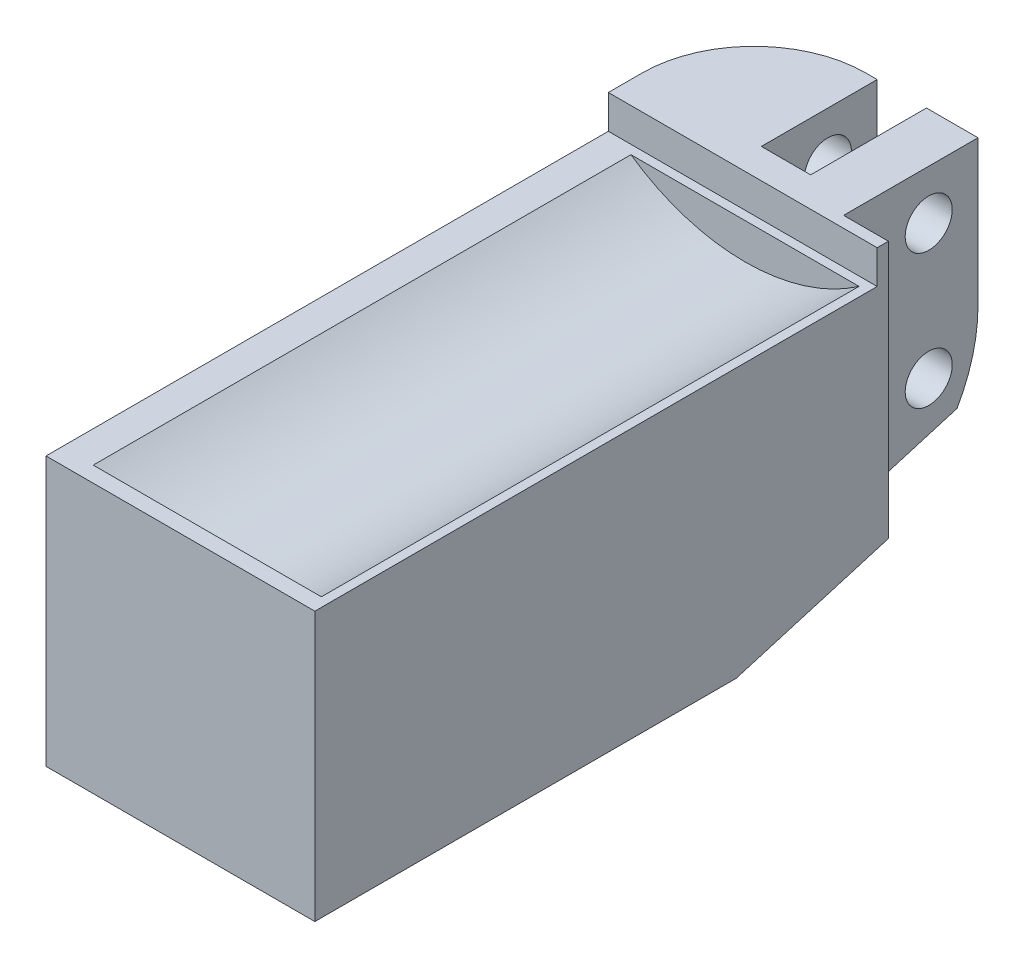
from build123d import *

# Parameters (mm, degrees)
BOSS_EXTRUDE1_DEPTH            = 3
BOSS_EXTRUDE1_DEPTH_BACK       = 12.8
SKETCH1_W                      = 6
SKETCH1_H                      = 6
SKETCH10_W                     = 6
SKETCH10_H                     = 3.25
BOSS_EXTRUDE2_DEPTH            = 0.75
CUT_EXTRUDE2_DEPTH             = 0.1
CUT_EXTRUDE2_DEPTH_BACK        = 1
CUT_EXTRUDE3_DEPTH             = 5.5
CUT_EXTRUDE3_DEPTH_BACK        = 6.5
SKETCH5_R                      = 4.45
CUT_EXTRUDE4_REACH             = 40.346
SKETCH7_R                      = 0.525
CUT_EXTRUDE4_DIRECTION_2_REACH = 40.346
SKETCH8_W                      = 3
SKETCH8_H                      = 6.75
CUT_EXTRUDE5_DEPTH             = 1
FILLET1_R                      = 3.5
FILLET1_R_2                    = 2.5
CUT_EXTRUDE7_DEPTH             = 39.676090947


with BuildPart() as part:
    # Sketch1 → Boss-Extrude1 (new, two sides: drawn at the far end of the back side and taken through both)
    with BuildSketch(Plane.XY.offset(-BOSS_EXTRUDE1_DEPTH_BACK)):
        with Locations((122, -33)):
            Rectangle(SKETCH1_W, SKETCH1_H)
    extrude(amount=BOSS_EXTRUDE1_DEPTH + BOSS_EXTRUDE1_DEPTH_BACK)

    # Sketch10 → Boss-Extrude2 (add)
    with BuildSketch(Plane(origin=(0, -30, 0), x_dir=(1, 0, 0), z_dir=(0, 1, 0))):
        with Locations((122, 11.175)):
            Rectangle(SKETCH10_W, SKETCH10_H)
    extrude(amount=BOSS_EXTRUDE2_DEPTH)

    # Sketch4 → Cut-Extrude2 (cut, two sides: drawn at the far end of the back side and taken through both)
    with BuildSketch(Plane.ZY.offset(-121.85).offset(-CUT_EXTRUDE2_DEPTH_BACK)):
        with BuildLine():
            Line((-11.776969868, -34.5), (-11.623346252, -34.5))
            ThreePointArc((-11.623346252, -34.5), (-10.835914556, -34.188123693), (-10.475580755, -33.421654477))
            Line((-10.475580755, -33.421654477), (-10.040343544, -26.45))
            Line((-10.040343544, -26.45), (-13.359649062, -26.45))
            Line((-13.359649062, -26.45), (-12.924738676, -33.421601422))
            ThreePointArc((-12.924738676, -33.421601422), (-12.564420934, -34.188105493), (-11.776969868, -34.5))
        make_face()
    extrude(amount=CUT_EXTRUDE2_DEPTH + CUT_EXTRUDE2_DEPTH_BACK, mode=Mode.SUBTRACT)

    # Sketch5 → Cut-Extrude3 (cut, two sides: drawn at the far end of the back side and taken through both)
    with BuildSketch(Plane(origin=(0, 0, -3.85), x_dir=(-1, 0, 0), z_dir=(0, 0, -1)).offset(-CUT_EXTRUDE3_DEPTH_BACK)):
        with Locations((-122.25, -26.35)):
            Circle(SKETCH5_R)
    extrude(amount=CUT_EXTRUDE3_DEPTH + CUT_EXTRUDE3_DEPTH_BACK, mode=Mode.SUBTRACT)

    # Cut-Extrude4: up to this face of the body (flat: up to its plane)
    cut_extrude4_end = Plane(part.part.faces().sort_by_distance((119, -32.915397223, -5.057298496))[0])
    # Sketch7 → Cut-Extrude4 (cut, up to the picked face)
    with BuildSketch(Plane(origin=(121.75, 0, 0), x_dir=(0, 0, -1), z_dir=(1, 0, 0)), mode=Mode.PRIVATE) as cut_extrude4_sk1:
        with Locations(Location((11.7, -33.35, 0), (0, 0, 90))):
            Circle(SKETCH7_R)
    cut_extrude4_tool1 = split(extrude(cut_extrude4_sk1.sketch, amount=-CUT_EXTRUDE4_REACH, mode=Mode.PRIVATE), bisect_by=cut_extrude4_end, keep=Keep.BOTH, mode=Mode.PRIVATE)
    # Sketch7 → Cut-Extrude4 (cut, up to the picked face)
    with BuildSketch(Plane(origin=(121.75, 0, 0), x_dir=(0, 0, -1), z_dir=(1, 0, 0)), mode=Mode.PRIVATE) as cut_extrude4_sk2:
        with Locations(Location((11.7, -30.35, 0), (0, 0, 90))):
            Circle(SKETCH7_R)
    cut_extrude4_tool2 = split(extrude(cut_extrude4_sk2.sketch, amount=-CUT_EXTRUDE4_REACH, mode=Mode.PRIVATE), bisect_by=cut_extrude4_end, keep=Keep.BOTH, mode=Mode.PRIVATE)
    add(cut_extrude4_tool1.solids().sort_by(Axis((121.75, -33.35, -11.7), (-1, 0, 0)))[0], mode=Mode.SUBTRACT)
    add(cut_extrude4_tool2.solids().sort_by(Axis((121.75, -30.35, -11.7), (-1, 0, 0)))[0], mode=Mode.SUBTRACT)

    # Cut-Extrude4 direction 2: up to this face of the body (flat: up to its plane)
    cut_extrude4_direction_2_end = Plane(part.part.faces().sort_by_distance((125, -32.915397223, -5.057298496))[0])
    # Sketch7 → Cut-Extrude4 direction 2 (cut, up to the picked face)
    with BuildSketch(Plane(origin=(121.75, 0, 0), x_dir=(0, 0, -1), z_dir=(1, 0, 0)), mode=Mode.PRIVATE) as cut_extrude4_direction_2_sk1:
        with Locations(Location((11.7, -33.35, 0), (0, 0, 90))):
            Circle(SKETCH7_R)
    cut_extrude4_direction_2_tool1 = split(extrude(cut_extrude4_direction_2_sk1.sketch, amount=CUT_EXTRUDE4_DIRECTION_2_REACH, mode=Mode.PRIVATE), bisect_by=cut_extrude4_direction_2_end, keep=Keep.BOTH, mode=Mode.PRIVATE)
    # Sketch7 → Cut-Extrude4 direction 2 (cut, up to the picked face)
    with BuildSketch(Plane(origin=(121.75, 0, 0), x_dir=(0, 0, -1), z_dir=(1, 0, 0)), mode=Mode.PRIVATE) as cut_extrude4_direction_2_sk2:
        with Locations(Location((11.7, -30.35, 0), (0, 0, 90))):
            Circle(SKETCH7_R)
    cut_extrude4_direction_2_tool2 = split(extrude(cut_extrude4_direction_2_sk2.sketch, amount=CUT_EXTRUDE4_DIRECTION_2_REACH, mode=Mode.PRIVATE), bisect_by=cut_extrude4_direction_2_end, keep=Keep.BOTH, mode=Mode.PRIVATE)
    add(cut_extrude4_direction_2_tool1.solids().sort_by(Axis((121.75, -33.35, -11.7), (1, 0, 0)))[0], mode=Mode.SUBTRACT)
    add(cut_extrude4_direction_2_tool2.solids().sort_by(Axis((121.75, -30.35, -11.7), (1, 0, 0)))[0], mode=Mode.SUBTRACT)

    # Sketch8 → Cut-Extrude5 (cut)
    with BuildSketch(Plane(origin=(125, 0, 0), x_dir=(0, 0, -1), z_dir=(1, 0, 0))):
        with Locations((11.3, -32.625)):
            Rectangle(SKETCH8_W, SKETCH8_H)
    extrude(amount=-CUT_EXTRUDE5_DEPTH, mode=Mode.SUBTRACT)

    # Fillet1
    # the kernel refuses this fillet: 3.5, 2.5 mm, written as the material it takes off along each edge
    with BuildSketch(Plane(origin=(132.75, -36, -12.8), x_dir=(0, 0, 1), z_dir=(-1, 0, 0))) as fillet1_piece_1:
        with BuildLine():
            CenterArc((FILLET1_R, FILLET1_R), FILLET1_R, 180, 90)
            Line((0, FILLET1_R), (0, 0))
            Line((0, 0), (FILLET1_R, 0))
        make_face()
    extrude(amount=22.5, mode=Mode.SUBTRACT)
    # the kernel refuses this fillet: 3.5, 2.5 mm, written as the material it takes off along each edge
    with BuildSketch(Plane(origin=(119, -23, -12.8), x_dir=(0, 0, 1), z_dir=(0, -1, 0))) as fillet1_2_piece_1:
        with BuildLine():
            CenterArc((FILLET1_R_2, -FILLET1_R_2), FILLET1_R_2, 90, 90)
            Line((0, -FILLET1_R_2), (0, 0))
            Line((0, 0), (FILLET1_R_2, 0))
        make_face()
    extrude(amount=15.75, mode=Mode.SUBTRACT)

    # Sketch12 → Cut-Extrude7 (cut, through all)
    with BuildSketch(Plane.ZY.offset(-119)):
        Polygon((-6.404787377, -36), (-12.404787377, -34.227808088), (-12.404787377, -36), align=None)
    extrude(amount=-CUT_EXTRUDE7_DEPTH, mode=Mode.SUBTRACT)


solid = part.part
